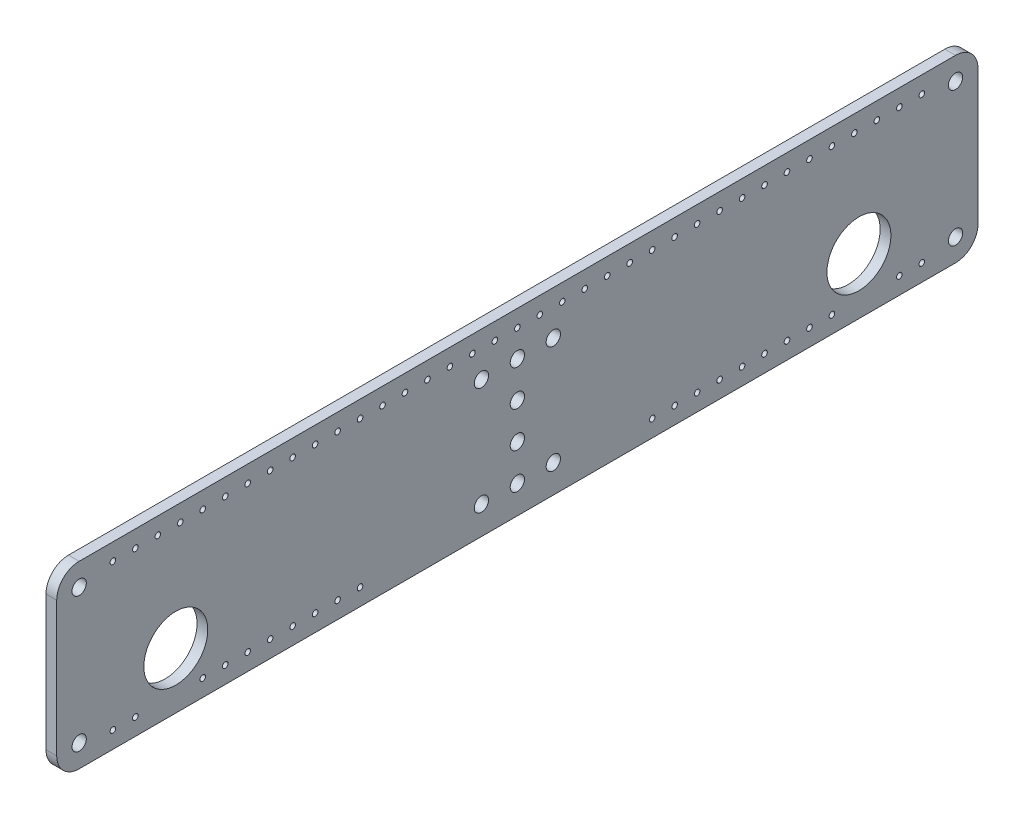
from build123d import *

# Parameters (mm, degrees)
SKETCH2_R           = 14.225
SKETCH2_R_2         = 3.18
SKETCH2_R_3         = 1.25
BOSS_EXTRUDE1_DEPTH = 4.7625


with BuildPart() as part:
    # Sketch2 → Boss-Extrude1 (new body)
    with BuildSketch(Plane(origin=(0, 0, 0), x_dir=(0, 0, -1), z_dir=(1, 0, 0))):
        with BuildLine():
            Line((-23.472321429, 28.668303571), (-23.472321429, -31.331696429))
            ThreePointArc((-23.472321429, -31.331696429), (-20.54338924, -38.40276424), (-13.472321429, -41.331696429))
            Line((-13.472321429, -41.331696429), (376.527678571, -41.331696429))
            ThreePointArc((376.527678571, -41.331696429), (383.598746383, -38.40276424), (386.527678571, -31.331696429))
            Line((386.527678571, -31.331696429), (386.527678571, 28.668303571))
            ThreePointArc((386.527678571, 28.668303571), (383.598746383, 35.739371383), (376.527678571, 38.668303571))
            Line((376.527678571, 38.668303571), (-13.472321429, 38.668303571))
            ThreePointArc((-13.472321429, 38.668303571), (-20.54338924, 35.739371383), (-23.472321429, 28.668303571))
        make_face()
        with Locations((29.527678571, -16.331696429)):
            Circle(SKETCH2_R, mode=Mode.SUBTRACT)
        with Locations((333.527678571, -16.331696429)):
            Circle(SKETCH2_R, mode=Mode.SUBTRACT)
        with Locations((181.527678571, -28.771696429)):
            Circle(SKETCH2_R_2, mode=Mode.SUBTRACT)
        with Locations((197.527678571, -28.771696429)):
            Circle(SKETCH2_R_2, mode=Mode.SUBTRACT)
        with Locations((197.527678571, 19.228303571)):
            Circle(SKETCH2_R_2, mode=Mode.SUBTRACT)
        with Locations((181.527678571, -12.771696429)):
            Circle(SKETCH2_R_2, mode=Mode.SUBTRACT)
        with Locations((181.527678571, 3.228303571)):
            Circle(SKETCH2_R_2, mode=Mode.SUBTRACT)
        with Locations((181.527678571, 19.228303571)):
            Circle(SKETCH2_R_2, mode=Mode.SUBTRACT)
        with Locations((165.527678571, -28.771696429)):
            Circle(SKETCH2_R_2, mode=Mode.SUBTRACT)
        with Locations((165.527678571, 19.228303571)):
            Circle(SKETCH2_R_2, mode=Mode.SUBTRACT)
        with Locations((1.527678571, 31.168303571)):
            Circle(SKETCH2_R_3, mode=Mode.SUBTRACT)
        with Locations((11.527678571, 31.168303571)):
            Circle(SKETCH2_R_3, mode=Mode.SUBTRACT)
        with Locations((21.527678571, 31.168303571)):
            Circle(SKETCH2_R_3, mode=Mode.SUBTRACT)
        with Locations((31.527678571, 31.168303571)):
            Circle(SKETCH2_R_3, mode=Mode.SUBTRACT)
        with Locations((41.527678571, 31.168303571)):
            Circle(SKETCH2_R_3, mode=Mode.SUBTRACT)
        with Locations((51.527678571, 31.168303571)):
            Circle(SKETCH2_R_3, mode=Mode.SUBTRACT)
        with Locations((61.527678571, 31.168303571)):
            Circle(SKETCH2_R_3, mode=Mode.SUBTRACT)
        with Locations((71.527678571, 31.168303571)):
            Circle(SKETCH2_R_3, mode=Mode.SUBTRACT)
        with Locations((81.527678571, 31.168303571)):
            Circle(SKETCH2_R_3, mode=Mode.SUBTRACT)
        with Locations((91.527678571, 31.168303571)):
            Circle(SKETCH2_R_3, mode=Mode.SUBTRACT)
        with Locations((101.527678571, 31.168303571)):
            Circle(SKETCH2_R_3, mode=Mode.SUBTRACT)
        with Locations((111.527678571, 31.168303571)):
            Circle(SKETCH2_R_3, mode=Mode.SUBTRACT)
        with Locations((121.527678571, 31.168303571)):
            Circle(SKETCH2_R_3, mode=Mode.SUBTRACT)
        with Locations((131.527678571, 31.168303571)):
            Circle(SKETCH2_R_3, mode=Mode.SUBTRACT)
        with Locations((141.527678571, 31.168303571)):
            Circle(SKETCH2_R_3, mode=Mode.SUBTRACT)
        with Locations((151.527678571, 31.168303571)):
            Circle(SKETCH2_R_3, mode=Mode.SUBTRACT)
        with Locations((161.527678571, 31.168303571)):
            Circle(SKETCH2_R_3, mode=Mode.SUBTRACT)
        with Locations((171.527678571, 31.168303571)):
            Circle(SKETCH2_R_3, mode=Mode.SUBTRACT)
        with Locations((181.527678571, 31.168303571)):
            Circle(SKETCH2_R_3, mode=Mode.SUBTRACT)
        with Locations((191.527678571, 31.168303571)):
            Circle(SKETCH2_R_3, mode=Mode.SUBTRACT)
        with Locations((201.527678571, 31.168303571)):
            Circle(SKETCH2_R_3, mode=Mode.SUBTRACT)
        with Locations((211.527678571, 31.168303571)):
            Circle(SKETCH2_R_3, mode=Mode.SUBTRACT)
        with Locations((221.527678571, 31.168303571)):
            Circle(SKETCH2_R_3, mode=Mode.SUBTRACT)
        with Locations((231.527678571, 31.168303571)):
            Circle(SKETCH2_R_3, mode=Mode.SUBTRACT)
        with Locations((241.527678571, 31.168303571)):
            Circle(SKETCH2_R_3, mode=Mode.SUBTRACT)
        with Locations((251.527678571, 31.168303571)):
            Circle(SKETCH2_R_3, mode=Mode.SUBTRACT)
        with Locations((261.527678571, 31.168303571)):
            Circle(SKETCH2_R_3, mode=Mode.SUBTRACT)
        with Locations((271.527678571, 31.168303571)):
            Circle(SKETCH2_R_3, mode=Mode.SUBTRACT)
        with Locations((281.527678571, 31.168303571)):
            Circle(SKETCH2_R_3, mode=Mode.SUBTRACT)
        with Locations((291.527678571, 31.168303571)):
            Circle(SKETCH2_R_3, mode=Mode.SUBTRACT)
        with Locations((301.527678571, 31.168303571)):
            Circle(SKETCH2_R_3, mode=Mode.SUBTRACT)
        with Locations((311.527678571, 31.168303571)):
            Circle(SKETCH2_R_3, mode=Mode.SUBTRACT)
        with Locations((321.527678571, 31.168303571)):
            Circle(SKETCH2_R_3, mode=Mode.SUBTRACT)
        with Locations((331.527678571, 31.168303571)):
            Circle(SKETCH2_R_3, mode=Mode.SUBTRACT)
        with Locations((341.527678571, 31.168303571)):
            Circle(SKETCH2_R_3, mode=Mode.SUBTRACT)
        with Locations((351.527678571, 31.168303571)):
            Circle(SKETCH2_R_3, mode=Mode.SUBTRACT)
        with Locations((361.527678571, 31.168303571)):
            Circle(SKETCH2_R_3, mode=Mode.SUBTRACT)
        with Locations((1.527678571, -33.831696429)):
            Circle(SKETCH2_R_3, mode=Mode.SUBTRACT)
        with Locations((11.527678571, -33.831696429)):
            Circle(SKETCH2_R_3, mode=Mode.SUBTRACT)
        with Locations((41.527678571, -33.831696429)):
            Circle(SKETCH2_R_3, mode=Mode.SUBTRACT)
        with Locations((51.527678571, -33.831696429)):
            Circle(SKETCH2_R_3, mode=Mode.SUBTRACT)
        with Locations((61.527678571, -33.831696429)):
            Circle(SKETCH2_R_3, mode=Mode.SUBTRACT)
        with Locations((71.527678571, -33.831696429)):
            Circle(SKETCH2_R_3, mode=Mode.SUBTRACT)
        with Locations((81.527678571, -33.831696429)):
            Circle(SKETCH2_R_3, mode=Mode.SUBTRACT)
        with Locations((91.527678571, -33.831696429)):
            Circle(SKETCH2_R_3, mode=Mode.SUBTRACT)
        with Locations((101.527678571, -33.831696429)):
            Circle(SKETCH2_R_3, mode=Mode.SUBTRACT)
        with Locations((111.527678571, -33.831696429)):
            Circle(SKETCH2_R_3, mode=Mode.SUBTRACT)
        with Locations((241.527678571, -33.831696429)):
            Circle(SKETCH2_R_3, mode=Mode.SUBTRACT)
        with Locations((251.527678571, -33.831696429)):
            Circle(SKETCH2_R_3, mode=Mode.SUBTRACT)
        with Locations((261.527678571, -33.831696429)):
            Circle(SKETCH2_R_3, mode=Mode.SUBTRACT)
        with Locations((271.527678571, -33.831696429)):
            Circle(SKETCH2_R_3, mode=Mode.SUBTRACT)
        with Locations((281.527678571, -33.831696429)):
            Circle(SKETCH2_R_3, mode=Mode.SUBTRACT)
        with Locations((291.527678571, -33.831696429)):
            Circle(SKETCH2_R_3, mode=Mode.SUBTRACT)
        with Locations((301.527678571, -33.831696429)):
            Circle(SKETCH2_R_3, mode=Mode.SUBTRACT)
        with Locations((311.527678571, -33.831696429)):
            Circle(SKETCH2_R_3, mode=Mode.SUBTRACT)
        with Locations((321.527678571, -33.831696429)):
            Circle(SKETCH2_R_3, mode=Mode.SUBTRACT)
        with Locations((351.527678571, -33.831696429)):
            Circle(SKETCH2_R_3, mode=Mode.SUBTRACT)
        with Locations((361.527678571, -33.831696429)):
            Circle(SKETCH2_R_3, mode=Mode.SUBTRACT)
        with Locations((-13.472321429, -31.331696429)):
            Circle(SKETCH2_R_2, mode=Mode.SUBTRACT)
        with Locations((-13.472321429, 28.668303571)):
            Circle(SKETCH2_R_2, mode=Mode.SUBTRACT)
        with Locations((376.527678571, -31.331696429)):
            Circle(SKETCH2_R_2, mode=Mode.SUBTRACT)
        with Locations((376.527678571, 28.668303571)):
            Circle(SKETCH2_R_2, mode=Mode.SUBTRACT)
    extrude(amount=BOSS_EXTRUDE1_DEPTH)


solid = part.part
